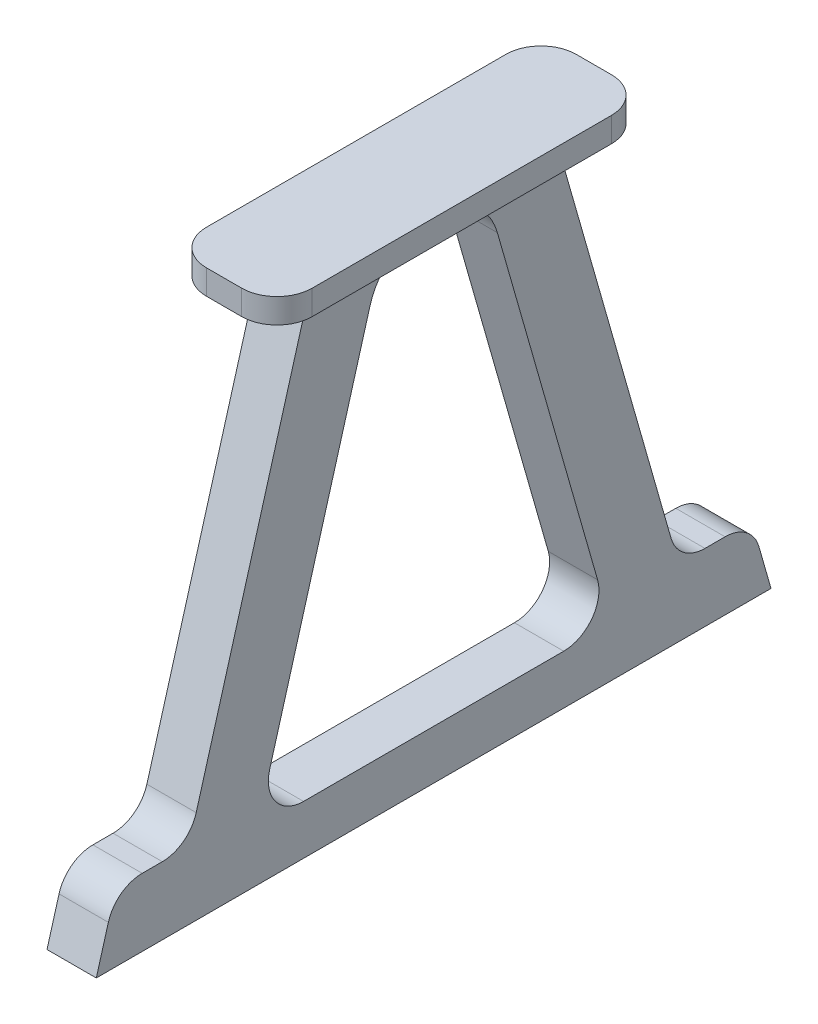
from build123d import *

# Parameters (mm, degrees)
BOSS_EXTRUDE3_DEPTH = 7
BOSS_EXTRUDE4_DEPTH = 7
FILLET2_R           = 10
SHELL8_START        = -4
SHELL8_DEPTH        = 8
SHELL8_START_2      = -5
SHELL8_2_OUTLINE_W  = 1
SHELL8_2_OUTLINE_H  = 99
SHELL8_2_DEPTH      = 10
SHELL8_3_DEPTH      = 1
SKETCH14_W          = 8
SKETCH14_H          = 185.360533748
BOSS_EXTRUDE5_DEPTH = 4
FILLET5_R           = 18.82495


with BuildPart() as part:
    # Sketch10 → Boss-Extrude3 (new body)
    with BuildSketch(Plane(origin=(0, 0, 0), x_dir=(1, 0, 0), z_dir=(0, 1, 0))):
        with BuildLine():
            Line((-5, -52.5), (5, -52.5))
            ThreePointArc((5, -52.5), (12.071067812, -49.571067812), (15, -42.5))
            Line((15, -42.5), (15, 42.5))
            ThreePointArc((15, 42.5), (12.071067812, 49.571067812), (5, 52.5))
            Line((5, 52.5), (-5, 52.5))
            ThreePointArc((-5, 52.5), (-12.071067812, 49.571067812), (-15, 42.5))
            Line((-15, 42.5), (-15, -42.5))
            ThreePointArc((-15, -42.5), (-12.071067812, -49.571067812), (-5, -52.5))
        make_face()
    extrude(amount=-BOSS_EXTRUDE3_DEPTH)

    # Sketch11 → Boss-Extrude4 (add, symmetric)
    with BuildSketch(Plane(origin=(0, 0, 0), x_dir=(0, 0, -1), z_dir=(1, 0, 0))):
        Polygon((-71, -133), (-69.505577442, -127.769521047), (-90.305891411, -127.769521047), (-95.800313969, -147), (-75, -147), align=None)
        Polygon((0, -133), (-50.199686031, -133), (-71, -133), (-75, -147), (0, -147), align=None)
        Polygon((50.199686031, -133), (0, -133), (0, -147), (75, -147), (71, -133), align=None)
        Polygon((-14.199686031, -7), (-35, -7), (-69.505577442, -127.769521047), (-71, -133), (-50.199686031, -133), align=None)
        Polygon((35, -7), (14.199686031, -7), (50.199686031, -133), (71, -133), (69.505577442, -127.769521047), align=None)
        Polygon((90.305891411, -127.769521047), (69.505577442, -127.769521047), (71, -133), (75, -147), (95.800313969, -147), align=None)
    extrude(amount=BOSS_EXTRUDE4_DEPTH, both=True)

    # Fillet2
    fillet2_edges = [part.edges().sort_by_distance(p)[0] for p in [
        (0, -133, -50.199686031),
        (0, -133, 50.199686031),
        (0, -127.769521047, 69.505577442),
        (0, -127.769521047, 90.305891411),
        (0, -127.769521047, -90.305891411),
        (0, -127.769521047, -69.505577442),
    ]]
    fillet(fillet2_edges, radius=FILLET2_R)

    # Shell8: read off the stored shape, not the designer's step
    # Shell8 outline → Shell8 (cut)
    with BuildSketch(Plane.YZ.offset(SHELL8_START)):
        with BuildLine():
            Line((-3, -49.5), (-3, 49.5))
            Line((-3, 49.5), (-4, 49.5))
            Line((-4, 49.5), (-4, 31.022810047))
            Line((-4, 31.022810047), (-121.34089571, 64.54878025))
            ThreePointArc((-121.34089571, 64.54878025), (-128.148053473, 69.220049899), (-130.769521047, 77.04859157))
            Line((-130.769521047, 77.04859157), (-130.769521047, 82.762877284))
            ThreePointArc((-130.769521047, 82.762877284), (-132.18108051, 86.978245876), (-135.846473152, 89.493544917))
            Line((-135.846473152, 89.493544917), (-147, 92.680266874))
            Line((-147, 92.680266874), (-147, -92.680266874))
            Line((-147, -92.680266874), (-135.846473152, -89.493544917))
            ThreePointArc((-135.846473152, -89.493544917), (-132.18108051, -86.978245876), (-130.769521047, -82.762877284))
            Line((-130.769521047, -82.762877284), (-130.769521047, -77.04859157))
            ThreePointArc((-130.769521047, -77.04859157), (-128.148053473, -69.220049899), (-121.34089571, -64.54878025))
            Line((-121.34089571, -64.54878025), (-4, -31.022810047))
            Line((-4, -31.022810047), (-4, -49.5))
            Line((-4, -49.5), (-3, -49.5))
        make_face()
        with BuildLine():
            Line((-4, 16.462590269), (-4, -16.462590269))
            Line((-4, -16.462590269), (-119.428625337, -49.442197508))
            ThreePointArc((-119.428625337, -49.442197508), (-130.828541671, -47.320918614), (-136, -36.942386189))
            Line((-136, -36.942386189), (-136, 36.942386189))
            ThreePointArc((-136, 36.942386189), (-130.828541671, 47.320918614), (-119.428625337, 49.442197508))
            Line((-119.428625337, 49.442197508), (-4, 16.462590269))
        make_face(mode=Mode.SUBTRACT)
    extrude(amount=SHELL8_DEPTH, mode=Mode.SUBTRACT)

    # Shell8 2 outline → Shell8 2 (cut)
    with BuildSketch(Plane.YZ.offset(SHELL8_START_2)):
        with Locations((-3.5, 0)):
            Rectangle(SHELL8_2_OUTLINE_W, SHELL8_2_OUTLINE_H)
    extrude(amount=SHELL8_2_DEPTH, mode=Mode.SUBTRACT)

    # Shell8 3 outline → Shell8 3 (cut)
    with BuildSketch(Plane(origin=(0, 0, 0), x_dir=(1, 0, 0), z_dir=(0, 1, 0)).offset(SHELL8_START)):
        with BuildLine():
            Line((5, 49.5), (5, -49.5))
            ThreePointArc((5, -49.5), (9.949747468, -47.449747468), (12, -42.5))
            Line((12, -42.5), (12, 42.5))
            ThreePointArc((12, 42.5), (9.949747468, 47.449747468), (5, 49.5))
        make_face()
        with BuildLine():
            Line((-12, 42.5), (-12, -42.5))
            ThreePointArc((-12, -42.5), (-9.949747468, -47.449747468), (-5, -49.5))
            Line((-5, -49.5), (-5, 49.5))
            ThreePointArc((-5, 49.5), (-9.949747468, 47.449747468), (-12, 42.5))
        make_face()
    extrude(amount=SHELL8_3_DEPTH, mode=Mode.SUBTRACT)

    # Sketch14 → Boss-Extrude5 (add)
    with BuildSketch(Plane.XZ.offset(147)):
        Rectangle(SKETCH14_W, SKETCH14_H)
    extrude(amount=-BOSS_EXTRUDE5_DEPTH)

    # Fillet5
    fillet5_edges = [part.edges().sort_by_distance(p)[0] for p in [
        (0, -7, 14.199686031),
        (0, -7, -14.199686031),
    ]]
    fillet(fillet5_edges, radius=FILLET5_R - 0.0001)  # a hair under: the kernel refuses the full size


solid = part.part
